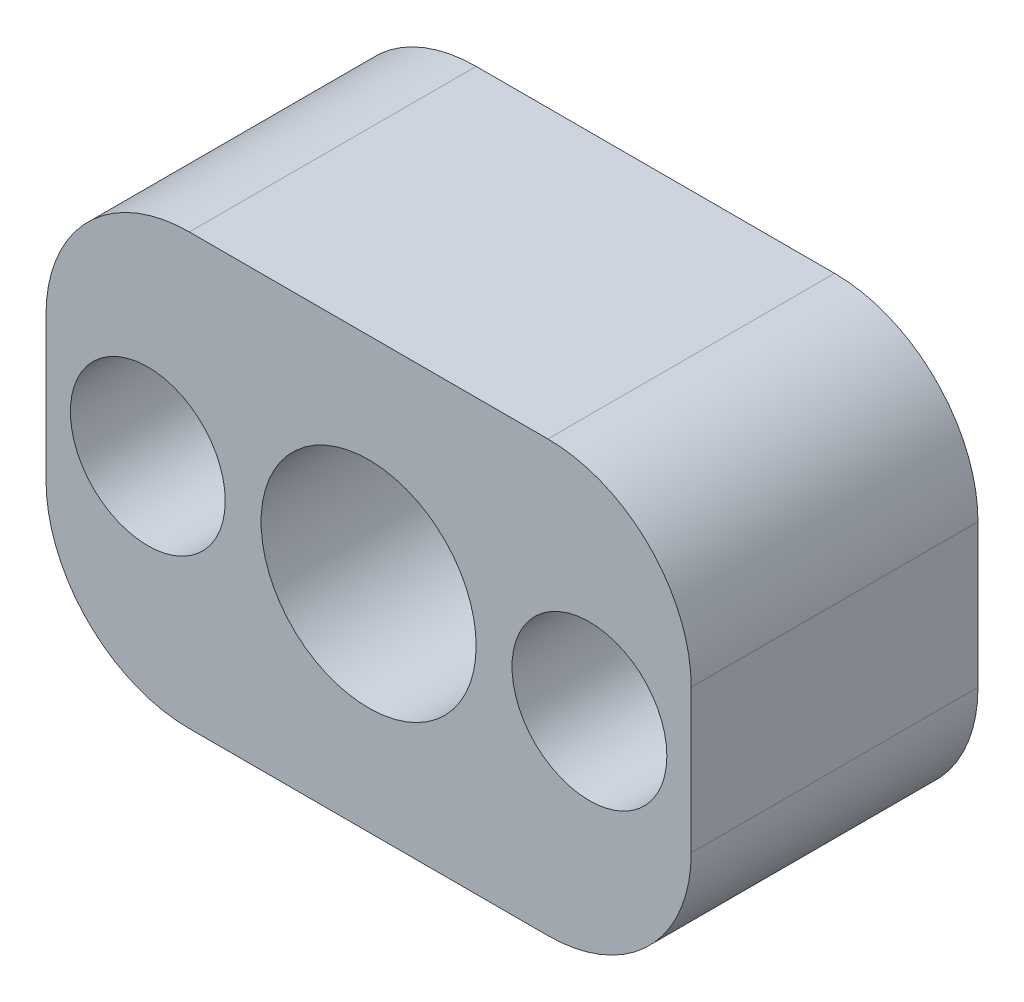
from build123d import *

# Parameters (mm, degrees)
SKETCH1_W           = 28.575
SKETCH1_H           = 19.05
SKETCH1_R           = 1.778
SKETCH1_R_2         = 4.7625
BOSS_EXTRUDE1_DEPTH = 12.7
FILLET1_R           = 6.35
SKETCH2_R           = 3.429
CUT_EXTRUDE1_DEPTH  = 6.35


with BuildPart() as part:
    # Sketch1 → Boss-Extrude1 (new body)
    with BuildSketch(Plane.XY):
        with Locations((-14.2875, -9.525)):
            Rectangle(SKETCH1_W, SKETCH1_H)
        with Locations((-4.5085, -9.525)):
            Circle(SKETCH1_R, mode=Mode.SUBTRACT)
        with Locations((-14.2875, -9.525)):
            Circle(SKETCH1_R_2, mode=Mode.SUBTRACT)
        with Locations((-24.0665, -9.525)):
            Circle(SKETCH1_R, mode=Mode.SUBTRACT)
    extrude(amount=BOSS_EXTRUDE1_DEPTH)

    # Fillet1
    fillet1_edges = [part.edges().sort_by_distance(p)[0] for p in [
        (-28.575, 0, 6.35),
        (-28.575, -19.05, 6.35),
        (0, -19.05, 6.35),
        (0, 0, 6.35),
    ]]
    fillet(fillet1_edges, radius=FILLET1_R)

    # Sketch2 → Cut-Extrude1 (cut)
    with BuildSketch(Plane.XY.offset(12.7)):
        with Locations((-24.0665, -9.525)):
            Circle(SKETCH2_R)
        with Locations((-4.5085, -9.525)):
            Circle(SKETCH2_R)
    extrude(amount=-CUT_EXTRUDE1_DEPTH, mode=Mode.SUBTRACT)


solid = part.part
